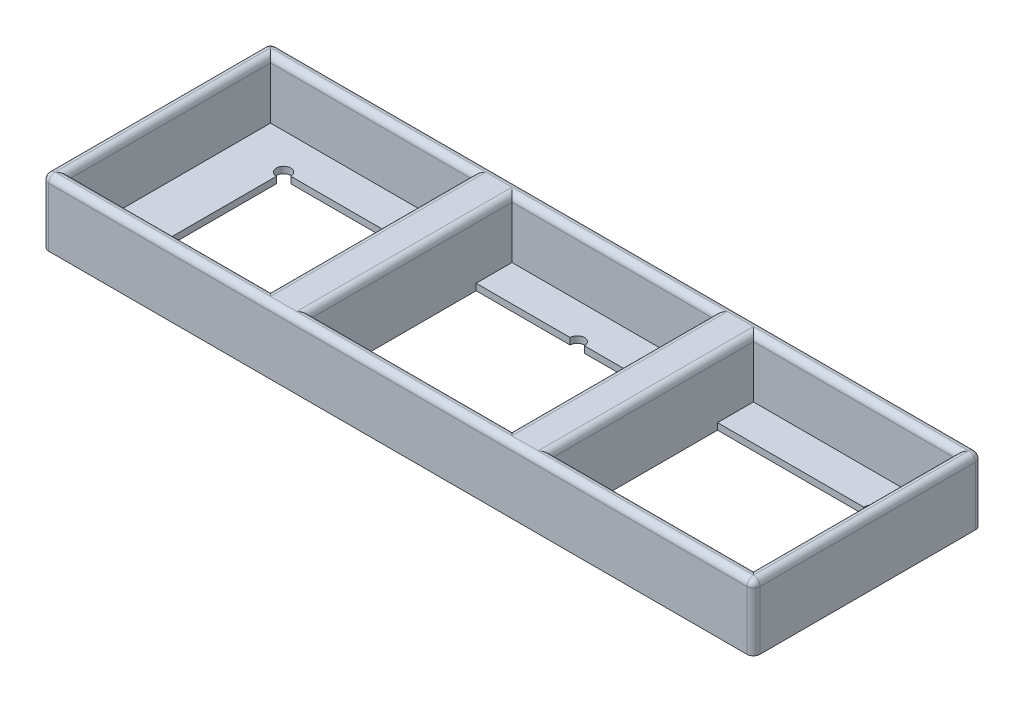
from build123d import *

# Parameters (mm, degrees)
EXTRUDE_1_DEPTH   = 1
EXTRUDE_1_2_DEPTH = 1
EXTRUDE_1_3_DEPTH = 1
EXTRUDE_1_4_DEPTH = 1
SKETCH_1_3_W      = 109
SKETCH_1_3_H      = 35
SKETCH_1_3_W_2    = 105
SKETCH_1_3_H_2    = 31
SKETCH_1_3_W_3    = 6
SKETCH_1_3_H_3    = 20
SKETCH_1_3_H_4    = 5.5
EXTRUDE_2_DEPTH   = 10
FILLET_1_R        = 1
FILLET_2_R        = 1


with BuildPart() as part:
    # 草图1 → 凸台-拉伸1 (new body)
    with BuildSketch(Plane(origin=(0, 0, 0), x_dir=(1, 0, 0), z_dir=(0, 1, 0))):
        with BuildLine():
            Line((-21.5, 10), (-21.5, 15.5))
            Line((-21.5, 15.5), (-52.5, 15.5))
            Line((-52.5, 15.5), (-52.5, -15.5))
            Line((-52.5, -15.5), (-21.5, -15.5))
            Line((-21.5, -15.5), (-21.5, -10))
            Line((-21.5, -10), (-43.9, -10))
            ThreePointArc((-43.9, -10), (-45.777817459, -10.777817459), (-45, -8.9))
            Line((-45, -8.9), (-45, 8.9))
            ThreePointArc((-45, 8.9), (-45.777817459, 10.777817459), (-43.9, 10))
            Line((-43.9, 10), (-21.5, 10))
        make_face()
    extrude(amount=EXTRUDE_1_DEPTH)


with BuildPart() as body_2:
    # 草图1 → Extrude 1 2 (new body)
    with BuildSketch(Plane(origin=(0, 0, 0), x_dir=(1, 0, 0), z_dir=(0, 1, 0))):
        with BuildLine():
            Line((-1.1, -10), (-15.5, -10))
            Line((-15.5, -10), (-15.5, -15.5))
            Line((-15.5, -15.5), (15.5, -15.5))
            Line((15.5, -15.5), (15.5, -10))
            Line((15.5, -10), (1.1, -10))
            ThreePointArc((1.1, -10), (0, -11.1), (-1.1, -10))
        make_face()
    extrude(amount=EXTRUDE_1_2_DEPTH)


with BuildPart() as body_3:
    # 草图1 → Extrude 1 3 (new body)
    with BuildSketch(Plane(origin=(0, 0, 0), x_dir=(1, 0, 0), z_dir=(0, 1, 0))):
        with BuildLine():
            Line((15.5, 15.5), (-15.5, 15.5))
            Line((-15.5, 15.5), (-15.5, 10))
            Line((-15.5, 10), (-1.1, 10))
            ThreePointArc((-1.1, 10), (0, 11.1), (1.1, 10))
            Line((1.1, 10), (15.5, 10))
            Line((15.5, 10), (15.5, 15.5))
        make_face()
    extrude(amount=EXTRUDE_1_3_DEPTH)


with BuildPart() as body_4:
    # 草图1 → Extrude 1 4 (new body)
    with BuildSketch(Plane(origin=(0, 0, 0), x_dir=(1, 0, 0), z_dir=(0, 1, 0))):
        with BuildLine():
            Line((52.5, 15.5), (21.5, 15.5))
            Line((21.5, 15.5), (21.5, 10))
            Line((21.5, 10), (43.9, 10))
            ThreePointArc((43.9, 10), (45, 11.1), (46.1, 10))
            ThreePointArc((46.1, 10), (45.777817459, 9.222182541), (45, 8.9))
            Line((45, 8.9), (45, -8.9))
            ThreePointArc((45, -8.9), (45.777817459, -9.222182541), (46.1, -10))
            ThreePointArc((46.1, -10), (45, -11.1), (43.9, -10))
            Line((43.9, -10), (21.5, -10))
            Line((21.5, -10), (21.5, -15.5))
            Line((21.5, -15.5), (52.5, -15.5))
            Line((52.5, -15.5), (52.5, 15.5))
        make_face()
    extrude(amount=EXTRUDE_1_4_DEPTH)

    # 草图1<3> → 凸台-拉伸2 (add)
    # profile 1 of 7: a face of its own
    with BuildSketch(Plane(origin=(0, 0, 0), x_dir=(1, 0, 0), z_dir=(0, 1, 0))):
        Rectangle(SKETCH_1_3_W, SKETCH_1_3_H)
        Rectangle(SKETCH_1_3_W_2, SKETCH_1_3_H_2, mode=Mode.SUBTRACT)
    # profile 2 of 7: a face of its own
    with BuildSketch(Plane(origin=(0, 0, 0), x_dir=(1, 0, 0), z_dir=(0, 1, 0))):
        with Locations((-18.5, 0)):
            Rectangle(SKETCH_1_3_W_3, SKETCH_1_3_H_3)
    # profile 3 of 7: a face of its own
    with BuildSketch(Plane(origin=(0, 0, 0), x_dir=(1, 0, 0), z_dir=(0, 1, 0))):
        with Locations((18.5, 0)):
            Rectangle(SKETCH_1_3_W_3, SKETCH_1_3_H_3)
    # profile 4 of 7: a face of its own
    with BuildSketch(Plane(origin=(0, 0, 0), x_dir=(1, 0, 0), z_dir=(0, 1, 0))):
        with Locations((-18.5, 12.75)):
            Rectangle(SKETCH_1_3_W_3, SKETCH_1_3_H_4)
    # profile 5 of 7: a face of its own
    with BuildSketch(Plane(origin=(0, 0, 0), x_dir=(1, 0, 0), z_dir=(0, 1, 0))):
        with Locations((-18.5, -12.75)):
            Rectangle(SKETCH_1_3_W_3, SKETCH_1_3_H_4)
    # profile 6 of 7: a face of its own
    with BuildSketch(Plane(origin=(0, 0, 0), x_dir=(1, 0, 0), z_dir=(0, 1, 0))):
        with Locations((18.5, 12.75)):
            Rectangle(SKETCH_1_3_W_3, SKETCH_1_3_H_4)
    # profile 7 of 7: a face of its own
    with BuildSketch(Plane(origin=(0, 0, 0), x_dir=(1, 0, 0), z_dir=(0, 1, 0))):
        with Locations((18.5, -12.75)):
            Rectangle(SKETCH_1_3_W_3, SKETCH_1_3_H_4)
    extrude(amount=EXTRUDE_2_DEPTH)

    # 圆角1
    fillet_1_edges = [body_4.edges().sort_by_distance(p)[0] for p in [
        (0, 10, -17.5),
        (54.5, 5, -17.5),
        (-54.5, 5, -17.5),
        (-54.5, 5, 17.5),
        (54.5, 10, 0),
        (54.5, 5, 17.5),
        (-54.5, 10, 0),
        (0, 10, 17.5),
    ]]
    fillet(fillet_1_edges, radius=FILLET_1_R)

    # 圆角2
    fillet_2_edges = [body_4.edges().sort_by_distance(p)[0] for p in [
        (21.5, 10, 0),
        (-37, 10, 15.5),
        (37, 10, 15.5),
        (-15.5, 10, 0),
        (-52.5, 10, 0),
        (0, 10, 15.5),
        (0, 10, -15.5),
        (15.5, 10, 0),
        (37, 10, -15.5),
        (52.5, 10, 0),
        (-37, 10, -15.5),
        (-21.5, 10, 0),
    ]]
    fillet(fillet_2_edges, radius=FILLET_2_R - 0.0001)  # a hair under: the kernel refuses the full size


solid = Compound([part.part, body_2.part, body_3.part, body_4.part])
